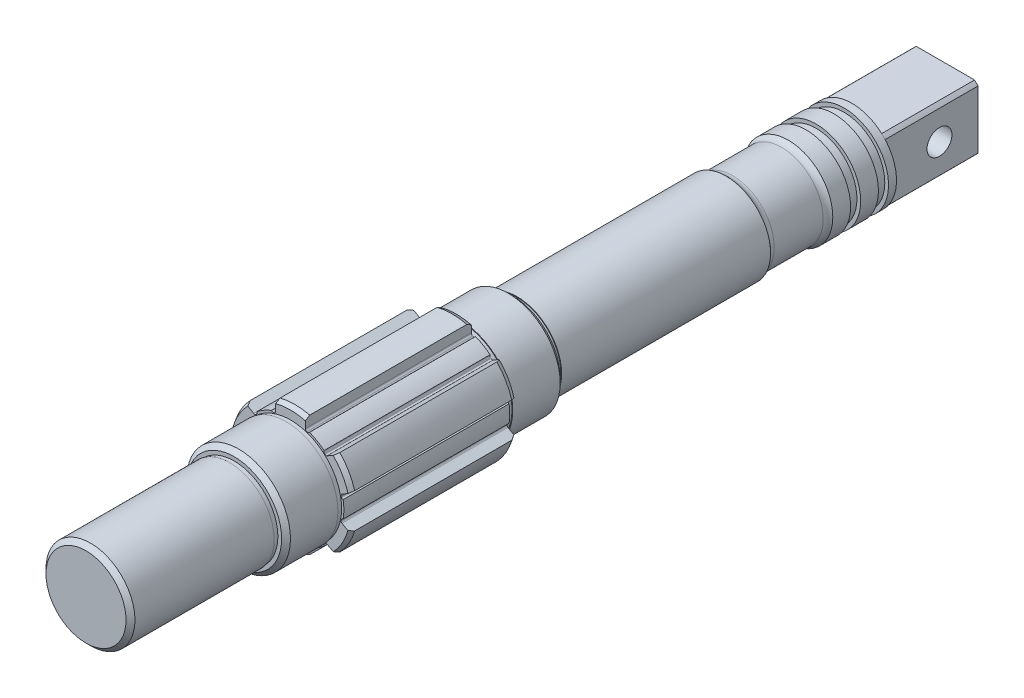
from build123d import *

# Parameters (mm, degrees)
EXTRUDE_1_DEPTH     = 31.5
SKETCH_2_R          = 4.2
CUT_EXTRUDE_1_DEPTH = 31.5
SKETCH_3_R          = 15
EXTRUDE_2_DEPTH     = 2.7
SKETCH_4_R          = 13.75
EXTRUDE_3_DEPTH     = 3.4
SKETCH_5_R          = 15
EXTRUDE_4_DEPTH     = 6
SKETCH_6_R          = 13.75
EXTRUDE_5_DEPTH     = 3.4
SKETCH_7_R          = 15
EXTRUDE_6_DEPTH     = 6
SKETCH_8_R          = 14
EXTRUDE_7_DEPTH     = 21
SKETCH_9_R          = 15
EXTRUDE_8_DEPTH     = 70.5
FILLET_1_R          = 3
FILLET_2_R          = 3
SKETCH_10_R         = 14.75
EXTRUDE_9_DEPTH     = 1.5
SKETCH_11_R         = 17.5
EXTRUDE_10_DEPTH    = 17.5
CHAMFER_1_SIZE      = 1.5
SKETCH_12_R         = 17.25
EXTRUDE_11_DEPTH    = 1.5
SKETCH_13_R         = 21
EXTRUDE_12_DEPTH    = 56
CHAMFER_2_SIZE      = 1.5
CHAMFER_2_SIZE2     = 0.866025404
CHAMFER_4_SIZE      = 1.5
CHAMFER_4_SIZE2     = 0.866025404
CUT_EXTRUDE_START   = -56
CUT_EXTRUDE_2_DEPTH = 56
SKETCH_16_R         = 17.25
EXTRUDE_13_DEPTH    = 1.5
SKETCH_17_R         = 17.5
EXTRUDE_14_DEPTH    = 17.5
CHAMFER_5_SIZE      = 1.5
SKETCH_18_R         = 14.75
EXTRUDE_15_DEPTH    = 1.5
SKETCH_19_R         = 15
EXTRUDE_16_DEPTH    = 48.5
CHAMFER_6_SIZE      = 1.5


with BuildPart() as part:
    # 草图1 → 凸台-拉伸1 (new body)
    with BuildSketch(Plane.XY):
        with BuildLine():
            Line((9.826622004, -11), (-9.826622004, -11))
            ThreePointArc((-9.826622004, -11), (-10.429825023, -10.429825023), (-11, -9.826622004))
            Line((-11, -9.826622004), (-11, 9.826622004))
            ThreePointArc((-11, 9.826622004), (-10.429825023, 10.429825023), (-9.826622004, 11))
            Line((-9.826622004, 11), (9.826622004, 11))
            ThreePointArc((9.826622004, 11), (10.429825023, 10.429825023), (11, 9.826622004))
            Line((11, 9.826622004), (11, -9.826622004))
            ThreePointArc((11, -9.826622004), (10.429825023, -10.429825023), (9.826622004, -11))
        make_face()
    extrude(amount=EXTRUDE_1_DEPTH)

    # 草图2 → 切除-拉伸1 (cut)
    with BuildSketch(Plane(origin=(11, 0, 0), x_dir=(0, 0, -1), z_dir=(1, 0, 0))):
        with Locations((-13, 0)):
            Circle(SKETCH_2_R)
    extrude(amount=-CUT_EXTRUDE_1_DEPTH, mode=Mode.SUBTRACT)

    # 草图3 → 凸台-拉伸2 (add)
    with BuildSketch(Plane.XY.offset(31.5)):
        with Locations(Location((0, 0, 0), (0, 0, 180))):
            Circle(SKETCH_3_R)
    extrude(amount=EXTRUDE_2_DEPTH)

    # 草图4 → 凸台-拉伸3 (add)
    with BuildSketch(Plane.XY.offset(34.2)):
        Circle(SKETCH_4_R)
    extrude(amount=EXTRUDE_3_DEPTH)

    # 草图5 → 凸台-拉伸4 (add)
    with BuildSketch(Plane.XY.offset(37.6)):
        with Locations(Location((0, 0, 0), (0, 0, 180))):
            Circle(SKETCH_5_R)
    extrude(amount=EXTRUDE_4_DEPTH)

    # 草图6 → 凸台-拉伸5 (add)
    with BuildSketch(Plane.XY.offset(43.6)):
        Circle(SKETCH_6_R)
    extrude(amount=EXTRUDE_5_DEPTH)

    # 草图7 → 凸台-拉伸6 (add)
    with BuildSketch(Plane.XY.offset(47)):
        with Locations(Location((0, 0, 0), (0, 0, 180))):
            Circle(SKETCH_7_R)
    extrude(amount=EXTRUDE_6_DEPTH)

    # 草图8 → 凸台-拉伸7 (add)
    with BuildSketch(Plane.XY.offset(53)):
        with Locations(Location((0, 0, 0), (0, 0, 180))):
            Circle(SKETCH_8_R)
    extrude(amount=EXTRUDE_7_DEPTH)

    # 草图9 → 凸台-拉伸8 (add)
    with BuildSketch(Plane.XY.offset(74)):
        with Locations(Location((0, 0, 0), (0, 0, 180))):
            Circle(SKETCH_9_R)
    extrude(amount=EXTRUDE_8_DEPTH)

    # 圆角1
    # the kernel refuses this fillet: 3 mm, written as the material it adds along each edge
    with BuildSketch(Plane(origin=(0, 0, 74), x_dir=(-1, 0, 0), z_dir=(0, 1, 0))) as fillet_1_piece_1:
        with BuildLine():
            CenterArc((17, -2.236067977), FILLET_1_R, 131.810314896, 48.189685104)
            Line((14, -2.236067977), (13.94, -2.236067977))
            Line((13.94, -2.236067977), (13.94, 0))
            Line((13.94, 0), (14, 0.06))
            ThreePointArc((14, 0.06), (14.5, 0.06), (14.96, 0.04472136))
            Line((14.96, 0.04472136), (15, 0))
        make_face()
    revolve(axis=Axis((0, 0, 74), (0, 0, 1)))

    # 圆角2
    # the kernel refuses this fillet: 3 mm, written as the material it adds along each edge
    with BuildSketch(Plane(origin=(0, 0, 53), x_dir=(-1, 0, 0), z_dir=(0, 1, 0))) as fillet_2_piece_1:
        with BuildLine():
            CenterArc((17, 2.236067977), FILLET_2_R, 180, 48.189685104)
            Line((15, 0), (14.96, -0.04472136))
            ThreePointArc((14.96, -0.04472136), (14.5, -0.06), (14, -0.06))
            Line((14, -0.06), (13.94, 0))
            Line((13.94, 0), (13.94, 2.236067977))
            Line((13.94, 2.236067977), (14, 2.236067977))
        make_face()
    revolve(axis=Axis((0, 0, 53), (0, 0, 1)))

    # 草图10 → 凸台-拉伸9 (add)
    with BuildSketch(Plane.XY.offset(144.5)):
        Circle(SKETCH_10_R)
    extrude(amount=EXTRUDE_9_DEPTH)

    # 草图11 → 凸台-拉伸10 (add)
    with BuildSketch(Plane.XY.offset(146)):
        Circle(SKETCH_11_R)
    extrude(amount=EXTRUDE_10_DEPTH)

    # 倒角1
    chamfer_1_edges = [part.edges().sort_by_distance(p)[0] for p in [
        (-17.5, 0, 146),
    ]]
    chamfer(chamfer_1_edges, length=CHAMFER_1_SIZE)

    # 草图12 → 凸台-拉伸11 (add)
    with BuildSketch(Plane.XY.offset(163.5)):
        Circle(SKETCH_12_R)
    extrude(amount=EXTRUDE_11_DEPTH)

    # 草图13 → 凸台-拉伸12 (add)
    with BuildSketch(Plane.XY.offset(165)):
        Circle(SKETCH_13_R)
    extrude(amount=EXTRUDE_12_DEPTH)

    # 倒角2
    chamfer_2_edges = [part.edges().sort_by_distance(p)[0] for p in [
        (-21, 0, 221),
    ]]
    chamfer_2_side = [part.faces().sort_by_distance(p)[0] for p in [
        (-21, 0, 193),
    ]]
    chamfer(chamfer_2_edges, length=CHAMFER_2_SIZE, length2=CHAMFER_2_SIZE2, reference=chamfer_2_side[0])

    # 倒角4
    chamfer_4_edges = [part.edges().sort_by_distance(p)[0] for p in [
        (-21, 0, 165),
    ]]
    chamfer_4_side = [part.faces().sort_by_distance(p)[0] for p in [
        (-21, 0, 192.25),
    ]]
    chamfer(chamfer_4_edges, length=CHAMFER_4_SIZE, length2=CHAMFER_4_SIZE2, reference=chamfer_4_side[0])

    # 草图15 → 切除-拉伸2 (cut)
    with BuildSketch(Plane.XY.offset(221).offset(CUT_EXTRUDE_START)):
        with BuildLine():
            Line((11.347361553, 13.954206742), (11.35464386, 13.966820068))
            ThreePointArc((11.35464386, 13.966820068), (9, 15.588457268), (6.418299059, 16.816820068))
            Line((6.418299059, 16.816820068), (6.411016751, 16.804206742))
            ThreePointArc((6.411016751, 16.804206742), (6.076529305, 16.520667374), (5.638085589, 16.514069483))
            ThreePointArc((5.638085589, 16.514069483), (5.542684825, 16.546333277), (5.447099448, 16.578045953))
            ThreePointArc((5.447099448, 16.578045953), (5.123509089, 16.814374316), (5, 17.195566289))
            Line((5, 17.195566289), (5, 20.396078054))
            ThreePointArc((5, 20.396078054), (10.5, 18.186533479), (15.163521733, 14.528166046))
            Line((15.163521733, 14.528166046), (12.391797239, 12.927910163))
            ThreePointArc((12.391797239, 12.927910163), (11.999920762, 12.844276185), (11.633459216, 13.006349475))
            ThreePointArc((11.633459216, 13.006349475), (11.558202545, 13.073272503), (11.482560897, 13.139760091))
            ThreePointArc((11.482560897, 13.139760091), (11.269052981, 13.522762433), (11.347361553, 13.954206742))
        make_face()
        with BuildLine():
            Line((17.758378304, -2.85), (17.772942919, -2.85))
            ThreePointArc((17.772942919, -2.85), (18, 0), (17.772942919, 2.85))
            Line((17.772942919, 2.85), (17.758378304, 2.85))
            ThreePointArc((17.758378304, 2.85), (17.345582286, 2.997904942), (17.120646487, 3.374309392))
            ThreePointArc((17.120646487, 3.374309392), (17.10088737, 3.473060775), (17.080558664, 3.571696478))
            ThreePointArc((17.080558664, 3.571696478), (17.123429851, 3.97009813), (17.391797239, 4.267656126))
            Line((17.391797239, 4.267656126), (20.163521733, 5.867912008))
            ThreePointArc((20.163521733, 5.867912008), (21, 0), (20.163521733, -5.867912008))
            Line((20.163521733, -5.867912008), (17.391797239, -4.267656126))
            ThreePointArc((17.391797239, -4.267656126), (17.123429851, -3.97009813), (17.080558664, -3.571696478))
            ThreePointArc((17.080558664, -3.571696478), (17.10088737, -3.473060775), (17.120646487, -3.374309392))
            ThreePointArc((17.120646487, -3.374309392), (17.345582286, -2.997904942), (17.758378304, -2.85))
        make_face()
        with BuildLine():
            Line((6.411016751, -16.804206742), (6.418299059, -16.816820068))
            ThreePointArc((6.418299059, -16.816820068), (9, -15.588457268), (11.35464386, -13.966820068))
            Line((11.35464386, -13.966820068), (11.347361553, -13.954206742))
            ThreePointArc((11.347361553, -13.954206742), (11.269052981, -13.522762433), (11.482560897, -13.139760091))
            ThreePointArc((11.482560897, -13.139760091), (11.558202545, -13.073272503), (11.633459216, -13.006349475))
            ThreePointArc((11.633459216, -13.006349475), (11.999920762, -12.844276185), (12.391797239, -12.927910163))
            Line((12.391797239, -12.927910163), (15.163521733, -14.528166046))
            ThreePointArc((15.163521733, -14.528166046), (10.5, -18.186533479), (5, -20.396078054))
            Line((5, -20.396078054), (5, -17.195566289))
            ThreePointArc((5, -17.195566289), (5.123509089, -16.814374316), (5.447099448, -16.578045953))
            ThreePointArc((5.447099448, -16.578045953), (5.542684825, -16.546333277), (5.638085589, -16.514069483))
            ThreePointArc((5.638085589, -16.514069483), (6.076529305, -16.520667374), (6.411016751, -16.804206742))
        make_face()
        with BuildLine():
            Line((-6.411016751, 16.804206742), (-6.418299059, 16.816820068))
            ThreePointArc((-6.418299059, 16.816820068), (-9, 15.588457268), (-11.35464386, 13.966820068))
            Line((-11.35464386, 13.966820068), (-11.347361553, 13.954206742))
            ThreePointArc((-11.347361553, 13.954206742), (-11.269052981, 13.522762433), (-11.482560897, 13.139760091))
            ThreePointArc((-11.482560897, 13.139760091), (-11.558202545, 13.073272503), (-11.633459216, 13.006349475))
            ThreePointArc((-11.633459216, 13.006349475), (-11.999920762, 12.844276185), (-12.391797239, 12.927910163))
            Line((-12.391797239, 12.927910163), (-15.163521733, 14.528166046))
            ThreePointArc((-15.163521733, 14.528166046), (-10.5, 18.186533479), (-5, 20.396078054))
            Line((-5, 20.396078054), (-5, 17.195566289))
            ThreePointArc((-5, 17.195566289), (-5.123509089, 16.814374316), (-5.447099448, 16.578045953))
            ThreePointArc((-5.447099448, 16.578045953), (-5.542684825, 16.546333277), (-5.638085589, 16.514069483))
            ThreePointArc((-5.638085589, 16.514069483), (-6.076529305, 16.520667374), (-6.411016751, 16.804206742))
        make_face()
        with BuildLine():
            Line((-11.347361553, -13.954206742), (-11.35464386, -13.966820068))
            ThreePointArc((-11.35464386, -13.966820068), (-9, -15.588457268), (-6.418299059, -16.816820068))
            Line((-6.418299059, -16.816820068), (-6.411016751, -16.804206742))
            ThreePointArc((-6.411016751, -16.804206742), (-6.076529305, -16.520667374), (-5.638085589, -16.514069483))
            ThreePointArc((-5.638085589, -16.514069483), (-5.542684825, -16.546333277), (-5.447099448, -16.578045953))
            ThreePointArc((-5.447099448, -16.578045953), (-5.123509089, -16.814374316), (-5, -17.195566289))
            Line((-5, -17.195566289), (-5, -20.396078054))
            ThreePointArc((-5, -20.396078054), (-10.5, -18.186533479), (-15.163521733, -14.528166046))
            Line((-15.163521733, -14.528166046), (-12.391797239, -12.927910163))
            ThreePointArc((-12.391797239, -12.927910163), (-11.999920762, -12.844276185), (-11.633459216, -13.006349475))
            ThreePointArc((-11.633459216, -13.006349475), (-11.558202545, -13.073272503), (-11.482560897, -13.139760091))
            ThreePointArc((-11.482560897, -13.139760091), (-11.269052981, -13.522762433), (-11.347361553, -13.954206742))
        make_face()
        with BuildLine():
            Line((-17.758378304, 2.85), (-17.772942919, 2.85))
            ThreePointArc((-17.772942919, 2.85), (-18, 0), (-17.772942919, -2.85))
            Line((-17.772942919, -2.85), (-17.758378304, -2.85))
            ThreePointArc((-17.758378304, -2.85), (-17.345582286, -2.997904942), (-17.120646487, -3.374309392))
            ThreePointArc((-17.120646487, -3.374309392), (-17.10088737, -3.473060775), (-17.080558664, -3.571696478))
            ThreePointArc((-17.080558664, -3.571696478), (-17.123429851, -3.97009813), (-17.391797239, -4.267656126))
            Line((-17.391797239, -4.267656126), (-20.163521733, -5.867912008))
            ThreePointArc((-20.163521733, -5.867912008), (-21, 0), (-20.163521733, 5.867912008))
            Line((-20.163521733, 5.867912008), (-17.391797239, 4.267656126))
            ThreePointArc((-17.391797239, 4.267656126), (-17.123429851, 3.97009813), (-17.080558664, 3.571696478))
            ThreePointArc((-17.080558664, 3.571696478), (-17.10088737, 3.473060775), (-17.120646487, 3.374309392))
            ThreePointArc((-17.120646487, 3.374309392), (-17.345582286, 2.997904942), (-17.758378304, 2.85))
        make_face()
    extrude(amount=CUT_EXTRUDE_2_DEPTH, mode=Mode.SUBTRACT)

    # 草图16 → 凸台-拉伸13 (add)
    with BuildSketch(Plane.XY.offset(221)):
        Circle(SKETCH_16_R)
    extrude(amount=EXTRUDE_13_DEPTH)

    # 草图17 → 凸台-拉伸14 (add)
    with BuildSketch(Plane.XY.offset(222.5)):
        Circle(SKETCH_17_R)
    extrude(amount=EXTRUDE_14_DEPTH)

    # 倒角5
    chamfer_5_edges = [part.edges().sort_by_distance(p)[0] for p in [
        (-17.5, 0, 240),
    ]]
    chamfer(chamfer_5_edges, length=CHAMFER_5_SIZE)

    # 草图18 → 凸台-拉伸15 (add)
    with BuildSketch(Plane.XY.offset(240)):
        Circle(SKETCH_18_R)
    extrude(amount=EXTRUDE_15_DEPTH)

    # 草图19 → 凸台-拉伸16 (add)
    with BuildSketch(Plane.XY.offset(241.5)):
        with Locations(Location((0, 0, 0), (0, 0, 180))):
            Circle(SKETCH_19_R)
    extrude(amount=EXTRUDE_16_DEPTH)

    # 倒角6
    chamfer_6_edges = [part.edges().sort_by_distance(p)[0] for p in [
        (15, 0, 290),
    ]]
    chamfer(chamfer_6_edges, length=CHAMFER_6_SIZE)


solid = part.part
